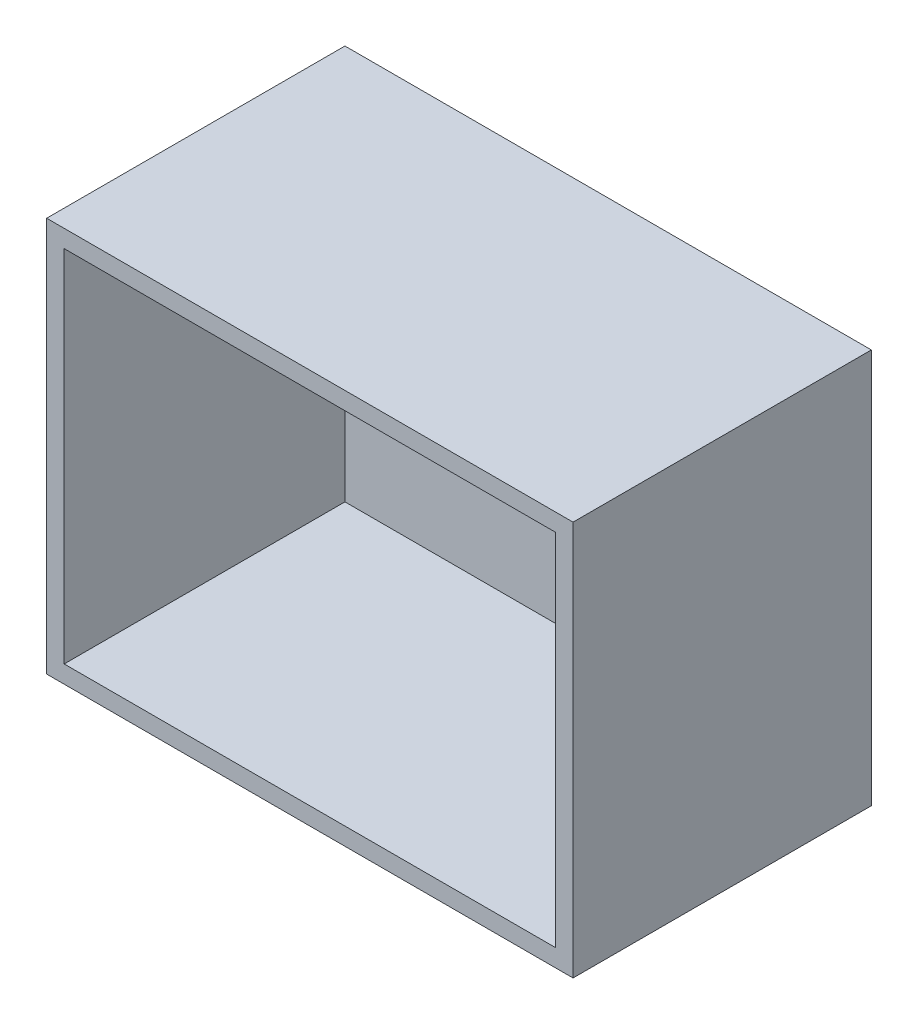
from build123d import *

# Parameters (mm, degrees)
SKETCH1_W           = 300
SKETCH1_H           = 170
BOSS_EXTRUDE1_DEPTH = 225
SHELL1_T            = -10
SKETCH2_R           = 6.5
CUT_EXTRUDE1_DEPTH  = 10
CIRPATTERN1_COUNT   = 4
SKETCH6_R           = 6
CUT_EXTRUDE2_DEPTH  = 408.707002638


with BuildPart() as part:
    # Sketch1 → Boss-Extrude1 (new body)
    with BuildSketch(Plane(origin=(0, 0, 0), x_dir=(1, 0, 0), z_dir=(0, 1, 0))):
        with Locations((-150, -85)):
            Rectangle(SKETCH1_W, SKETCH1_H)
    extrude(amount=BOSS_EXTRUDE1_DEPTH)

    # Shell1
    shell1_openings = [part.faces().sort_by_distance(p)[0] for p in [
        (-150, 112.5, 170),
    ]]
    offset(amount=SHELL1_T, openings=shell1_openings, kind=Kind.INTERSECTION)

    # Sketch2 → Cut-Extrude1 (cut)
    with BuildSketch(Plane.XY.offset(10)):
        with Locations((-260, 112.5)):
            Circle(SKETCH2_R)
    extrude(amount=-CUT_EXTRUDE1_DEPTH, mode=Mode.SUBTRACT)

    # Sketch5 → M5 Clearance Hole1 (revolve, cut)
    with BuildSketch(Plane(origin=(-244.090097423, 128.409902577, 10), x_dir=(0, -1, 0), z_dir=(1, 0, 0))):
        Polygon((0, 0), (0, 21.652366702), (2.75, 20), (2.75, 0.025), (2.775, 0), align=None)
    m5_clearance_hole1 = revolve(axis=Axis((-244.090097423, 128.409902577, 16.35), (0, 0, -1)), mode=Mode.SUBTRACT)

    # CirPattern1: M5 Clearance Hole1 ×4 about axis
    cirpattern1_axis = Axis((-260, 112.5, 10), (0, 0, 1))
    for i in range(1, CIRPATTERN1_COUNT):
        add(m5_clearance_hole1.rotate(cirpattern1_axis, i * 360 / CIRPATTERN1_COUNT), mode=Mode.SUBTRACT)

    # Sketch6 → Cut-Extrude2 (cut, through all)
    with BuildSketch(Plane.XY.offset(10)):
        with Locations((-150, 112.5)):
            Circle(SKETCH6_R)
        with Locations((-182, 144.5)):
            Circle(SKETCH6_R)
        with Locations((-118, 144.5)):
            Circle(SKETCH6_R)
        with Locations((-118, 80.5)):
            Circle(SKETCH6_R)
        with Locations((-182, 80.5)):
            Circle(SKETCH6_R)
    extrude(amount=-CUT_EXTRUDE2_DEPTH, mode=Mode.SUBTRACT)


solid = part.part
